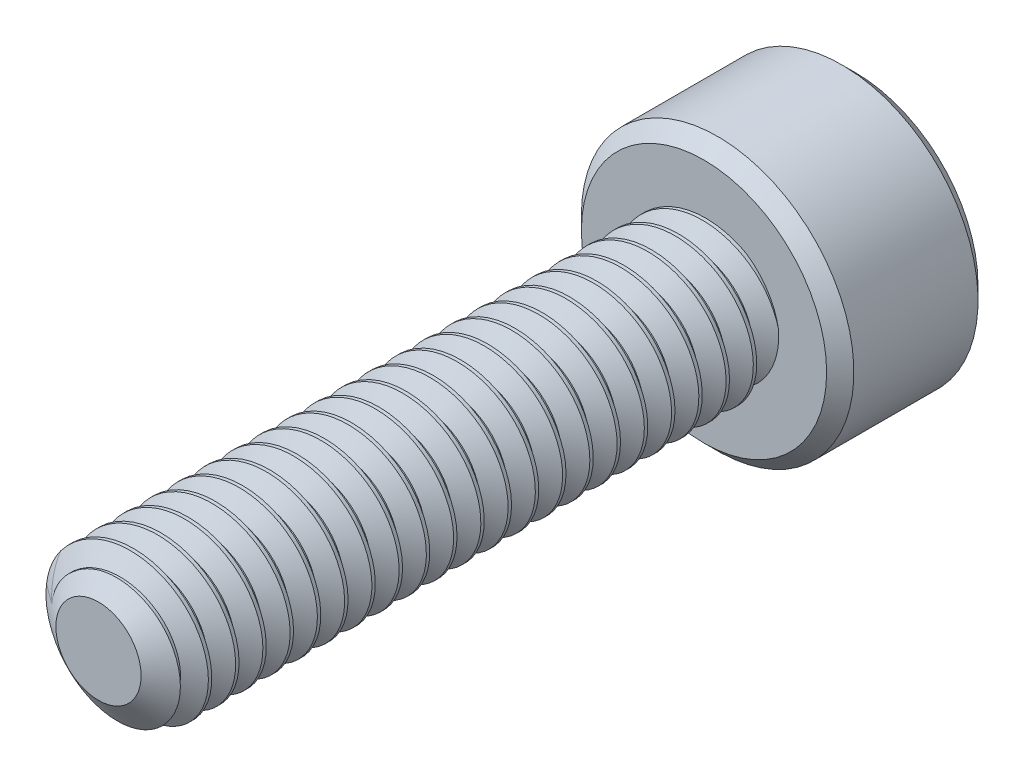
from build123d import *

# Parameters (mm, degrees)
SKETCH1_R          = 1.25
EXTRUDE1_DEPTH     = 10
CUT_SWEEP1_PITCH   = 0.45
SKETCH6_R          = 2.25
EXTRUDE2_DEPTH     = 2.5
CUT_EXTRUDE1_DEPTH = 1.5
CHAMFER1_SIZE      = 0.225


with BuildPart() as part:
    # Sketch1 → Extrude1 (new body)
    with BuildSketch(Plane.XY):
        Circle(SKETCH1_R)
    extrude(amount=-EXTRUDE1_DEPTH)

    # Cut-Sweep1: the profile of Sketch3 profile screwed along a right-hand helix of 23.222222 turns, 6 arcs to a turn; built about Z, then put on its axis
    cut_sweep1_z = Axis((0, 0, 0), (0, 0, 1))
    cut_sweep1_corners = [(1.2503, 0, -0.393923205), (0.957716426, 0, -0.225), (0.957716426, 0, -0.16875), (1.2503, 0, 0.000173205)]
    with BuildLine(mode=Mode.PRIVATE) as cut_sweep1_profile:
        Line(cut_sweep1_corners[0], cut_sweep1_corners[1])
        Line(cut_sweep1_corners[1], cut_sweep1_corners[2])
        Line(cut_sweep1_corners[2], cut_sweep1_corners[3])
        Line(cut_sweep1_corners[3], cut_sweep1_corners[0])
    cut_sweep1_cap = Face(cut_sweep1_profile.wire())
    cut_sweep1_turn_angles = [0, 30, 60, 90, 120, 150, 180, 210, 240, 270, 300, 330, 360]
    cut_sweep1_turn_weights = [1, 0.8660254037844387, 1, 0.8660254037844387, 1, 0.8660254037844387, 1, 0.8660254037844387, 1, 0.8660254037844387, 1, 0.8660254037844387, 1]
    cut_sweep1_turn_rails = [Edge.make_bspline([Vector(p[0], p[1], 0).rotate(cut_sweep1_z, cut_sweep1_turn_angles[k]) / cut_sweep1_turn_weights[k] + Vector(0, 0, p[2] + CUT_SWEEP1_PITCH * cut_sweep1_turn_angles[k] / 360) for k in range(13)], [0, 0, 0, 1, 1, 2, 2, 3, 3, 4, 4, 5, 5, 6, 6, 6], 2, cut_sweep1_turn_weights) for p in cut_sweep1_corners]
    cut_sweep1_turn_sides = [Face.make_surface_from_curves(cut_sweep1_turn_rails[p[0]], cut_sweep1_turn_rails[p[1]]) for p in [(0, 1), (1, 2), (2, 3), (3, 0)]]
    cut_sweep1_last_angles = [8280, 8310, 8340, 8350, 8360]
    cut_sweep1_last_weights = [1, 0.8660254037844387, 1, 0.9848077530121639, 1]
    cut_sweep1_last_rails = [Edge.make_bspline([Vector(p[0], p[1], 0).rotate(cut_sweep1_z, cut_sweep1_last_angles[k]) / cut_sweep1_last_weights[k] + Vector(0, 0, p[2] + CUT_SWEEP1_PITCH * cut_sweep1_last_angles[k] / 360) for k in range(5)], [0, 0, 0, 1, 1, 2, 2, 2], 2, cut_sweep1_last_weights) for p in cut_sweep1_corners]
    cut_sweep1_last_sides = [Face.make_surface_from_curves(cut_sweep1_last_rails[p[0]], cut_sweep1_last_rails[p[1]]) for p in [(0, 1), (1, 2), (2, 3), (3, 0)]]
    cut_sweep1 = Plane(origin=(0, 0, 0), x_dir=(0, 1, 0), z_dir=(0, 0, -1)) * Solid(Shell([*[p.moved(Location((0, 0, CUT_SWEEP1_PITCH * i))) for i in range(23) for p in cut_sweep1_turn_sides], *cut_sweep1_last_sides, cut_sweep1_cap, cut_sweep1_cap.rotate(cut_sweep1_z, 8360).moved(Location((0, 0, CUT_SWEEP1_PITCH * 8360 / 360)))]))
    add(cut_sweep1, mode=Mode.SUBTRACT)

    # Sketch4 → Cut-Revolve1 (revolve, cut)
    with BuildSketch(Plane(origin=(0, 0, 0), x_dir=(0, 0, -1), z_dir=(1, 0, 0)), mode=Mode.PRIVATE) as cut_revolve1_sk:
        Polygon((0.382511876, 1.25), (0, 0.703716426), (0, 1.25), align=None)
    revolve(cut_revolve1_sk.sketch.rotate(Axis((0, 0, 0), (0, 0, -1)), 276.971148597), axis=Axis((0, 0, 0), (0, 0, -1)), mode=Mode.SUBTRACT)

    # Sketch6 → Extrude2 (add)
    with BuildSketch(Plane(origin=(0, 0, -10), x_dir=(-1, 0, 0), z_dir=(0, 0, -1))):
        Circle(SKETCH6_R)
    extrude(amount=EXTRUDE2_DEPTH)

    # Sketch7 → Cut-Extrude1 (cut)
    with BuildSketch(Plane(origin=(0, 0, -12.5), x_dir=(-1, 0, 0), z_dir=(0, 0, -1))):
        Polygon((0, 1.154700538), (-1, 0.577350269), (-1, -0.577350269), (0, -1.154700538), (1, -0.577350269), (1, 0.577350269), align=None)
    extrude(amount=-CUT_EXTRUDE1_DEPTH, mode=Mode.SUBTRACT)

    # Cut-Extrude2 cone 1 section (through the dimple's axis) → Cut-Extrude2 (revolve, cut)
    with BuildSketch(Plane(origin=(0, 0, -12.5), x_dir=(0, 1, 0), z_dir=(1, 0, 0))):
        Polygon((0, 0), (1.154700538, 0), (0, 1.154700538), align=None)
    revolve(axis=Axis((0, 0, -12.5), (0, 0, 1)), mode=Mode.SUBTRACT)

    # Chamfer1
    chamfer1_edges = [part.edges().sort_by_distance(p)[0] for p in [
        (2.25, 0, -10),
        (2.25, 0, -12.5),
    ]]
    chamfer(chamfer1_edges, length=CHAMFER1_SIZE)


solid = part.part
